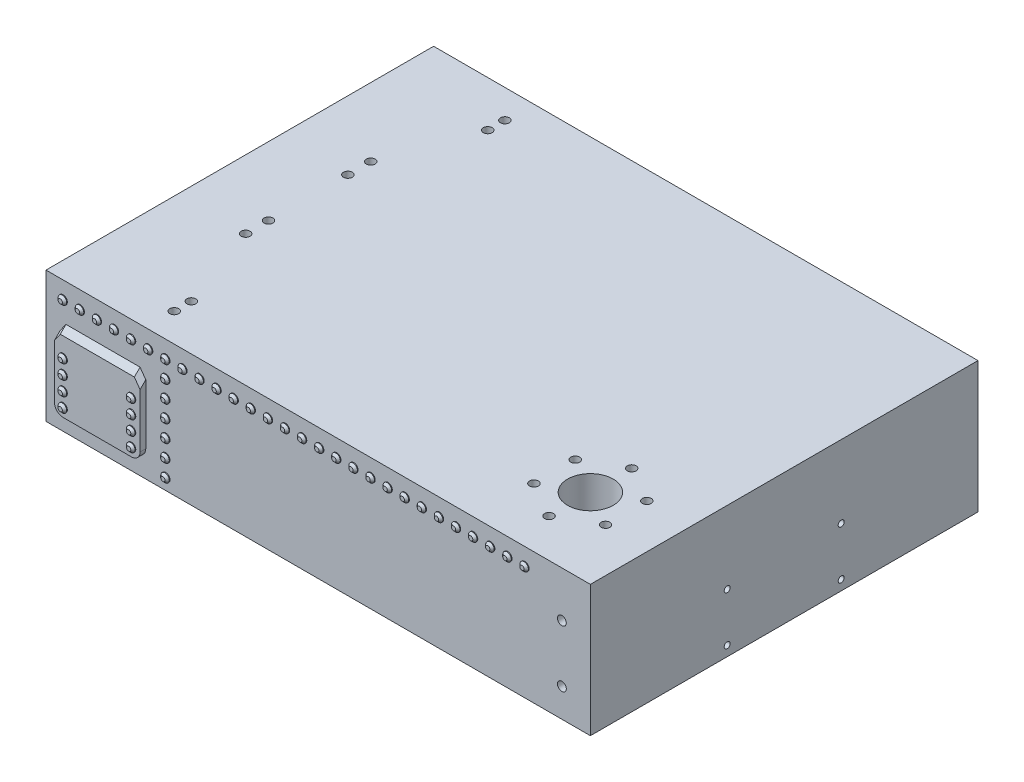
from build123d import *

# Parameters (mm, degrees)
BOSS_EXTRUDE1_DEPTH       = 46
CUT_EXTRUDE1_DEPTH        = 41
BOSS_EXTRUDE2_DEPTH       = 2
CHAMFER2_SIZE             = 2
FILLET1_R                 = 3
BOSS_EXTRUDE3_DEPTH       = 2
CHAMFER4_SIZE             = 2
FILLET2_R                 = 3
SKETCH23_R                = 1.4999999999999998
SKETCH23_R_2              = 1.5000000000000002
SKETCH23_R_3              = 1.5000000000000042
SKETCH23_R_4              = 1.5000000000000009
BOSS_EXTRUDE8_DEPTH       = 1
CHAMFER11_SIZE            = 0.75
CHAMFER11_OF_MIRROR1_SIZE = 0.75
SKETCH18_R                = 1.5000000000000013
BOSS_EXTRUDE7_DEPTH       = 14
SKETCH24_R                = 1.5000000000000018
SKETCH24_R_2              = 1.5000000000000009
SKETCH24_R_3              = 1.5000000000000042
SKETCH24_R_4              = 1.4999999999999973
BOSS_EXTRUDE9_DEPTH       = 1
CHAMFER12_SIZE            = 0.75
CHAMFER12_OF_MIRROR3_SIZE = 0.75
SKETCH25_R                = 1.5499999479999795
SKETCH25_R_2              = 1.54999994799998
CUT_EXTRUDE3_DEPTH        = 238.80874668523023
SKETCH26_R                = 1.54999994799998
SKETCH26_R_2              = 1.5499999479999795
CUT_EXTRUDE4_DEPTH        = 238.80874668523023
SKETCH28_R                = 1.549999948000008
SKETCH28_R_2              = 1.5499999479999795
SKETCH28_R_3              = 1.549999948000009
CUT_EXTRUDE5_DEPTH        = 240.75612609482997
SKETCH28_3_R              = 8.000000000000007
CUT_EXTRUDE6_DEPTH        = 240.75612609482997
BOSS_EXTRUDE10_START      = 40
SKETCH28_4_R              = 11.00000000000001
SKETCH28_4_R_2            = 8.000000000000007
BOSS_EXTRUDE10_DEPTH      = 40
CUT_EXTRUDE7_DEPTH        = 20
BOSS_EXTRUDE11_DEPTH      = 1.5
CIRPATTERN1_COUNT         = 6
CHAMFER13_SIZE            = 0.5
CUT_EXTRUDE8_REACH        = 241.756
SKETCH31_R                = 1.5500000000000007
SKETCH31_R_2              = 1.5500000000000012
SKETCH31_R_3              = 1.5499999999999932
CUT_EXTRUDE9_REACH        = 238.713
SKETCH32_R                = 1.549999999999994
SKETCH32_R_2              = 1.5499999999999992
CUT_EXTRUDE11_REACH       = 241.756
SKETCH35_R                = 1.5499999999999965
BOSS_EXTRUDE12_DEPTH      = 12
CHAMFER14_SIZE            = 2.999
SKETCH38_R                = 1.5499999999999932
SKETCH38_R_2              = 1.549999999999994
SKETCH38_R_3              = 1.5500000000000003
SKETCH38_R_4              = 1.549999999999999
CUT_EXTRUDE12_DEPTH       = 2
F_2_0MM_DOWEL_HOLE1_D     = 2
F_2_0MM_DOWEL_HOLE1_DEPTH = 12
F_2_0MM_DOWEL_HOLE1_TIP   = 0.6008606190275603
SKETCH43_R                = 1.0500000000000025
SKETCH43_R_2              = 1.049999999999995
SKETCH43_R_3              = 1.050000000000002
CUT_EXTRUDE13_DEPTH       = 237.71290628100536
CUT_EXTRUDE14_REACH       = 242.662
SKETCH44_R                = 1.0500000000000025
SKETCH44_R_2              = 1.049999999999995
SKETCH44_R_3              = 1.050000000000002


# Some blends are built 0.0001 mm under size
with BuildPart() as part:
    # Sketch1 → Boss-Extrude1 (new body)
    with BuildSketch(Plane(origin=(0, 0, 0), x_dir=(1, 0, 0), z_dir=(0, 1, 0))):
        Polygon((0, 0), (191, 0), (190.99999999999994, 136), (-5.551e-14, 136), align=None)
    extrude(amount=BOSS_EXTRUDE1_DEPTH)

    # Sketch3 → Cut-Extrude1 (cut)
    with BuildSketch(Plane.XZ):
        Polygon((4.999999999999945, -5), (186, -5), (186.00000000000003, -131), (4.9999999999999645, -131), align=None)
    extrude(amount=-CUT_EXTRUDE1_DEPTH, mode=Mode.SUBTRACT)

    # Sketch9 → Boss-Extrude2 (add)
    with BuildSketch(Plane(origin=(0, 0, -136), x_dir=(-1, 0, 0), z_dir=(0, 0, -1))):
        Polygon((-5.0000000000000275, 31), (-35.00000000000003, 30.999999999999996), (-34.99999999999994, 6.2152914347308945), (-4.9999999999999405, 6.215291434730898), align=None)
    extrude(amount=BOSS_EXTRUDE2_DEPTH)

    # Chamfer2
    chamfer2_edges = [part.edges().sort_by_distance(p)[0] for p in [
        (20.00000000000003, 31, -136),
    ]]
    chamfer(chamfer2_edges, length=CHAMFER2_SIZE - 0.0001)  # a hair under: the kernel refuses the full size

    # Fillet1
    fillet1_edges = [part.edges().sort_by_distance(p)[0] for p in [
        (4.9999999999999405, 6.215291434730898, -137),
        (34.99999999999994, 6.2152914347308945, -137),
    ]]
    fillet(fillet1_edges, radius=FILLET1_R)

    # Chamfer3
    # the kernel refuses this chamfer: 2 mm, written as the material it takes off along each edge
    with BuildSketch(Plane(origin=(35.00000000000005, 36.636808959705554, -132.36309104029445), x_dir=(-0.9996219169112968, 0.019442520806015526, -0.019442520806012088), z_dir=(-2.432610827546454e-15, -0.7071067811865476, -0.7071067811865476))) as chamfer3_piece_1_section:
        with BuildLine():
            Line((2.0573463903727274, 0), (-0.11309430977129796, -2.0542355870437667))
            Line((-0.11309430977129796, -2.0542355870437667), (-0.15307918644774898, -2.053135751979343))
            ThreePointArc((-0.15307918644774898, -2.053135751979343), (-0.06825845411927062, -1.0267956592897132), (-0.03998487667645102, 0.00109983506442341))
            Line((-0.03998487667645102, 0.00109983506442341), (0.00109983506442326, 0.03998487667644577))
            ThreePointArc((0.00109983506442326, 0.03998487667644577), (1.02899532941855, 0.01171129923362938), (2.0584462254371503, 0.03998487667644577))
            Line((2.0584462254371503, 0.03998487667644577), (2.0573463903727274, 0))
        make_face()
    chamfer3_piece_1 = extrude(amount=13.115017655253602, mode=Mode.PRIVATE)
    chamfer3_piece_1 = split(chamfer3_piece_1, bisect_by=Plane(origin=(34.18210852359201, 31.742511245489855, -136), z_dir=(0, 0, -1)), keep=Keep.TOP, mode=Mode.PRIVATE)
    add(chamfer3_piece_1, mode=Mode.SUBTRACT)
    with BuildSketch(Plane(origin=(5.000000000000047, 36.63680895970555, -132.36309104029445), x_dir=(-0.027495876610588645, -0.7068394360706732, 0.7068394360706735), z_dir=(-2.4832902197870053e-15, -0.7071067811865476, -0.7071067811865476))) as chamfer3_piece_2_section:
        with BuildLine():
            Line((2.0573463903727283, 0), (-0.11309430977130623, -2.054235587043767))
            Line((-0.11309430977130623, -2.054235587043767), (-0.15307918644775198, -2.053135751979344))
            ThreePointArc((-0.15307918644775198, -2.053135751979344), (-0.06825845411928508, -1.0267956592896998), (-0.03998487667644576, 0.00109983506442338))
            Line((-0.03998487667644576, 0.00109983506442338), (0.00109983506442355, 0.0399848766764519))
            ThreePointArc((0.00109983506442355, 0.0399848766764519), (1.0289953294185645, 0.0117112992336248), (2.0584462254371516, 0.03998487667645189))
            Line((2.0584462254371516, 0.03998487667645189), (2.0573463903727283, 0))
        make_face()
    chamfer3_piece_2 = extrude(amount=13.11501765525358, mode=Mode.PRIVATE)
    chamfer3_piece_2 = split(chamfer3_piece_2, bisect_by=Plane(origin=(5.81789147640913, 31.74251124548869, -136), z_dir=(0, 0, -1)), keep=Keep.TOP, mode=Mode.PRIVATE)
    add(chamfer3_piece_2, mode=Mode.SUBTRACT)

    # Sketch10 → Boss-Extrude3 (add)
    with BuildSketch(Plane.XY):
        Polygon((35.00000000000003, 30.999999999999996), (5.0000000000000275, 31), (4.9999999999999405, 6.215291434730898), (34.99999999999994, 6.2152914347308945), align=None)
    extrude(amount=BOSS_EXTRUDE3_DEPTH)

    # Chamfer4
    chamfer4_edges = [part.edges().sort_by_distance(p)[0] for p in [
        (20.00000000000003, 31, 0),
    ]]
    chamfer(chamfer4_edges, length=CHAMFER4_SIZE - 0.0001)  # a hair under: the kernel refuses the full size

    # Fillet2
    fillet2_edges = [part.edges().sort_by_distance(p)[0] for p in [
        (4.9999999999999405, 6.215291434730898, 1),
        (34.99999999999994, 6.2152914347308945, 1),
    ]]
    fillet(fillet2_edges, radius=FILLET2_R)

    # Chamfer5
    # the kernel refuses this chamfer: 2 mm, written as the material it takes off along each edge
    with BuildSketch(Plane(origin=(5.000000000000046, 36.636808959705554, -3.636908959705547), x_dir=(0.9996219169112968, 0.019442520806012466, 0.019442520806015978), z_dir=(-2.4832902197870053e-15, -0.7071067811865476, 0.7071067811865475))) as chamfer5_piece_1_section:
        with BuildLine():
            Line((2.057346390372729, 1e-17), (-0.11309430977131167, -2.0542355870437685))
            Line((-0.11309430977131167, -2.0542355870437685), (-0.15307918644776358, -2.053135751979345))
            ThreePointArc((-0.15307918644776358, -2.053135751979345), (-0.06825845411928075, -1.0267956592897038), (-0.0399848766764519, 0.00109983506442346))
            Line((-0.0399848766764519, 0.00109983506442346), (0.00109983506442354, 0.03998487667645487))
            ThreePointArc((0.00109983506442354, 0.03998487667645487), (1.0289953294185465, 0.01171129923363264), (2.058446225437152, 0.03998487667645488))
            Line((2.058446225437152, 0.03998487667645488), (2.057346390372729, 1e-17))
        make_face()
    chamfer5_piece_1 = extrude(amount=13.115017655253585, mode=Mode.PRIVATE)
    chamfer5_piece_1 = split(chamfer5_piece_1, bisect_by=Plane(origin=(5.81789147640932, 31.74251124548886, 0), z_dir=(0, 0, 1)), keep=Keep.TOP, mode=Mode.PRIVATE)
    add(chamfer5_piece_1, mode=Mode.SUBTRACT)
    with BuildSketch(Plane(origin=(35.00000000000005, 36.636808959705554, -3.636908959705554), x_dir=(0.027495876610582212, -0.7068394360706736, -0.7068394360706736), z_dir=(-2.432610827546454e-15, -0.7071067811865476, 0.7071067811865475))) as chamfer5_piece_2_section:
        with BuildLine():
            Line((2.0573463903727256, -1e-17), (-0.11309430977129922, -2.054235587043765))
            Line((-0.11309430977129922, -2.054235587043765), (-0.1530791864477541, -2.053135751979342))
            ThreePointArc((-0.1530791864477541, -2.053135751979342), (-0.06825845411927416, -1.0267956592897032), (-0.03998487667645487, 0.00109983506442337))
            Line((-0.03998487667645487, 0.00109983506442337), (0.00109983506442327, 0.03998487667645102))
            ThreePointArc((0.00109983506442327, 0.03998487667645102), (1.0289953294185419, 0.0117112992336214), (2.058446225437149, 0.039984876676451))
            Line((2.058446225437149, 0.039984876676451), (2.0573463903727256, -1e-17))
        make_face()
    chamfer5_piece_2 = extrude(amount=13.115017655253594, mode=Mode.PRIVATE)
    chamfer5_piece_2 = split(chamfer5_piece_2, bisect_by=Plane(origin=(34.18210852359054, 31.74251124548846, 0), z_dir=(0, 0, 1)), keep=Keep.TOP, mode=Mode.PRIVATE)
    add(chamfer5_piece_2, mode=Mode.SUBTRACT)

    # Sketch23 → Boss-Extrude8 (add)
    with BuildSketch(Plane.XY.offset(2)):
        with Locations((7.9999999999999165, 19.2152914347309)):
            Circle(SKETCH23_R)
        with Locations((7.999999999999934, 14.215291434730899)):
            Circle(SKETCH23_R)
        with Locations((7.999999999999952, 9.215291434730897)):
            Circle(SKETCH23_R_2)
        with Locations((31.999999999999954, 9.215291434730894)):
            Circle(SKETCH23_R_3)
        with Locations((31.999999999999932, 14.215291434730895)):
            Circle(SKETCH23_R_3)
        with Locations((31.99999999999992, 19.215291434730894)):
            Circle(SKETCH23_R_3)
        with Locations((31.999999999999897, 24.215291434730894)):
            Circle(SKETCH23_R_3)
        with Locations((7.9999999999999, 24.215291434730897)):
            Circle(SKETCH23_R_4)
    boss_extrude8 = extrude(amount=BOSS_EXTRUDE8_DEPTH)

    # Chamfer11
    chamfer11_edges = [part.edges().sort_by_distance(p)[0] for p in [
        (6.4999999999999165, 19.2152914347309, 3),
        (6.499999999999934, 14.215291434730899, 3),
        (6.499999999999952, 9.215291434730897, 3),
        (30.49999999999995, 9.215291434730894, 3),
        (30.49999999999993, 14.215291434730895, 3),
        (30.499999999999915, 19.215291434730894, 3),
        (30.499999999999893, 24.215291434730894, 3),
        (6.499999999999899, 24.215291434730897, 3),
    ]]
    chamfer(chamfer11_edges, length=CHAMFER11_SIZE)

    # Mirror1: Boss-Extrude8 across plane
    add(boss_extrude8.mirror(Plane.XY.offset(-68)))

    # Chamfer11 of Mirror1
    chamfer11_of_mirror1_edges = [part.edges().sort_by_distance(p)[0] for p in [
        (6.4999999999999165, 19.2152914347309, -139),
        (6.499999999999934, 14.215291434730899, -139),
        (6.499999999999952, 9.215291434730897, -139),
        (30.49999999999995, 9.215291434730894, -139),
        (30.49999999999993, 14.215291434730895, -139),
        (30.499999999999915, 19.215291434730894, -139),
        (30.499999999999893, 24.215291434730894, -139),
        (6.499999999999899, 24.215291434730897, -139),
    ]]
    chamfer(chamfer11_of_mirror1_edges, length=CHAMFER11_OF_MIRROR1_SIZE)

    # Sketch18 → Boss-Extrude7 (add)
    # profile 1 of 8: a face of its own
    with BuildSketch(Plane.XZ.offset(-41)):
        Polygon((72.47031053752059, -69.16911511108783), (76.12968946247946, -69.1691151110878), (77.95937892495886, -66.00000000000006), (76.12968946247942, -62.830884888912294), (72.47031053752053, -62.83088488891231), (70.64062107504112, -66.00000000000009), align=None)
        with Locations((74.3, -66.00000000000006)):
            Circle(SKETCH18_R, mode=Mode.SUBTRACT)
    # profile 2 of 8: a face of its own
    with BuildSketch(Plane.XZ.offset(-41)):
        with Locations((74.3, -66.00000000000006)):
            Circle(SKETCH18_R)
    # profile 3 of 8: a face of its own
    with BuildSketch(Plane.XZ.offset(-41)):
        Polygon((72.27927405783633, -117.50000000000004), (76.32072594216369, -117.50000000000004), (78.3414518843274, -114.00000000000003), (76.32072594216372, -110.50000000000007), (72.27927405783633, -110.50000000000007), (70.25854811567265, -114.00000000000006), align=None)
        with Locations((74.30000000000003, -114.00000000000004)):
            Circle(SKETCH18_R, mode=Mode.SUBTRACT)
    # profile 4 of 8: a face of its own
    with BuildSketch(Plane.XZ.offset(-41)):
        with Locations((74.30000000000003, -114.00000000000004)):
            Circle(SKETCH18_R)
    # profile 5 of 8: a face of its own
    with BuildSketch(Plane.XZ.offset(-41)):
        Polygon((172.47927405783636, -116.50000000000001), (176.52072594216372, -116.49999999999997), (178.5414518843274, -113.00000000000001), (176.5207259421637, -109.50000000000003), (172.4792740578363, -109.50000000000004), (170.45854811567264, -113.00000000000004), align=None)
        with Locations((174.50000000000003, -113.00000000000001)):
            Circle(SKETCH18_R, mode=Mode.SUBTRACT)
    # profile 6 of 8: a face of its own
    with BuildSketch(Plane.XZ.offset(-41)):
        with Locations((174.50000000000003, -113.00000000000001)):
            Circle(SKETCH18_R)
    # profile 7 of 8: a face of its own
    with BuildSketch(Plane.XZ.offset(-41)):
        Polygon((172.47927405783628, -64.00000000000003), (176.5207259421637, -64.00000000000003), (178.5414518843274, -60.50000000000004), (176.52072594216366, -57.00000000000001), (172.4792740578363, -57.00000000000001), (170.45854811567258, -60.50000000000005), align=None)
        with Locations((174.5, -60.50000000000003)):
            Circle(SKETCH18_R, mode=Mode.SUBTRACT)
    # profile 8 of 8: a face of its own
    with BuildSketch(Plane.XZ.offset(-41)):
        with Locations((174.5, -60.50000000000003)):
            Circle(SKETCH18_R)
    extrude(amount=BOSS_EXTRUDE7_DEPTH)

    # Sketch24 → Boss-Extrude9 (add)
    with BuildSketch(Plane.XY):
        with Locations(Location((6, 40, 0), (0, 0, 180))):
            Circle(SKETCH24_R)
        with Locations(Location((12, 40, 0), (0, 0, 180))):
            Circle(SKETCH24_R_2)
        with Locations(Location((18.000000000000004, 40, 0), (0, 0, 180))):
            Circle(SKETCH24_R_2)
        with Locations(Location((24, 40, 0), (0, 0, 180))):
            Circle(SKETCH24_R_3)
        with Locations(Location((30, 40, 0), (0, 0, 180))):
            Circle(SKETCH24_R_3)
        with Locations(Location((36, 40, 0), (0, 0, 180))):
            Circle(SKETCH24_R_3)
        with Locations(Location((42, 40, 0), (0, 0, 180))):
            Circle(SKETCH24_R_3)
        with Locations(Location((48, 40, 0), (0, 0, 180))):
            Circle(SKETCH24_R_3)
        with Locations(Location((54, 40, 0), (0, 0, 180))):
            Circle(SKETCH24_R_3)
        with Locations(Location((60, 40, 0), (0, 0, 180))):
            Circle(SKETCH24_R_3)
        with Locations(Location((66, 40, 0), (0, 0, 180))):
            Circle(SKETCH24_R_4)
        with Locations(Location((72.00000000000001, 40, 0), (0, 0, 180))):
            Circle(SKETCH24_R_4)
        with Locations(Location((78.00000000000001, 40, 0), (0, 0, 180))):
            Circle(SKETCH24_R_4)
        with Locations(Location((84, 40, 0), (0, 0, 180))):
            Circle(SKETCH24_R_4)
        with Locations(Location((90.00000000000001, 40, 0), (0, 0, 180))):
            Circle(SKETCH24_R_4)
        with Locations(Location((96, 40, 0), (0, 0, 180))):
            Circle(SKETCH24_R_4)
        with Locations(Location((102.00000000000001, 40, 0), (0, 0, 180))):
            Circle(SKETCH24_R_4)
        with Locations(Location((108.00000000000001, 40, 0), (0, 0, 180))):
            Circle(SKETCH24_R_4)
        with Locations(Location((114, 40, 0), (0, 0, 180))):
            Circle(SKETCH24_R_4)
        with Locations(Location((120.00000000000001, 40, 0), (0, 0, 180))):
            Circle(SKETCH24_R_4)
        with Locations(Location((126, 40, 0), (0, 0, 180))):
            Circle(SKETCH24_R_4)
        with Locations(Location((132, 40, 0), (0, 0, 180))):
            Circle(SKETCH24_R_4)
        with Locations(Location((138, 40, 0), (0, 0, 180))):
            Circle(SKETCH24_R_4)
        with Locations(Location((144.00000000000003, 40, 0), (0, 0, 180))):
            Circle(SKETCH24_R_4)
        with Locations(Location((150.00000000000003, 40, 0), (0, 0, 180))):
            Circle(SKETCH24_R_4)
        with Locations(Location((156, 40, 0), (0, 0, 180))):
            Circle(SKETCH24_R_4)
        with Locations(Location((162, 40, 0), (0, 0, 180))):
            Circle(SKETCH24_R_4)
        with Locations(Location((168, 40, 0), (0, 0, 180))):
            Circle(SKETCH24_R_4)
        with Locations(Location((42.000000000000064, 34, 0), (0, 0, 180))):
            Circle(SKETCH24_R_3)
        with Locations(Location((42.00000000000013, 28, 0), (0, 0, 180))):
            Circle(SKETCH24_R_3)
        with Locations(Location((42.00000000000019, 22, 0), (0, 0, 180))):
            Circle(SKETCH24_R_3)
        with Locations(Location((42.000000000000256, 16, 0), (0, 0, 180))):
            Circle(SKETCH24_R_3)
        with Locations(Location((42.00000000000031, 10.000000000000002, 0), (0, 0, 180))):
            Circle(SKETCH24_R_3)
        with Locations(Location((42.00000000000038, 3.9999999999999964, 0), (0, 0, 180))):
            Circle(SKETCH24_R_3)
    boss_extrude9 = extrude(amount=BOSS_EXTRUDE9_DEPTH)

    # Chamfer12
    chamfer12_edges = [part.edges().sort_by_distance(p)[0] for p in [
        (7.500000000000002, 40, 1),
        (13.5, 40, 1),
        (19.500000000000004, 40, 1),
        (25.500000000000004, 40, 1),
        (31.500000000000004, 40, 1),
        (37.50000000000001, 40, 1),
        (43.50000000000001, 40, 1),
        (49.50000000000001, 40, 1),
        (55.50000000000001, 40, 1),
        (61.50000000000001, 40, 1),
        (67.5, 40, 1),
        (73.50000000000001, 40, 1),
        (79.50000000000001, 40, 1),
        (85.5, 40, 1),
        (91.50000000000001, 40, 1),
        (97.5, 40, 1),
        (103.50000000000001, 40, 1),
        (109.50000000000001, 40, 1),
        (115.5, 40, 1),
        (121.50000000000001, 40, 1),
        (127.5, 40, 1),
        (133.5, 40, 1),
        (139.5, 40, 1),
        (145.50000000000003, 40, 1),
        (151.50000000000003, 40, 1),
        (157.5, 40, 1),
        (163.5, 40, 1),
        (169.5, 40, 1),
        (43.50000000000007, 34, 1),
        (43.500000000000135, 28, 1),
        (43.5000000000002, 22, 1),
        (43.50000000000026, 16, 1),
        (43.50000000000032, 10.000000000000002, 1),
        (43.500000000000384, 3.999999999999996, 1),
    ]]
    chamfer(chamfer12_edges, length=CHAMFER12_SIZE)

    # Mirror3: Boss-Extrude9 across plane
    add(boss_extrude9.mirror(Plane.XY.offset(-68)))

    # Chamfer12 of Mirror3
    chamfer12_of_mirror3_edges = [part.edges().sort_by_distance(p)[0] for p in [
        (7.500000000000002, 40, -137),
        (13.5, 40, -137),
        (19.500000000000004, 40, -137),
        (25.500000000000004, 40, -137),
        (31.500000000000004, 40, -137),
        (37.50000000000001, 40, -137),
        (43.50000000000001, 40, -137),
        (49.50000000000001, 40, -137),
        (55.50000000000001, 40, -137),
        (61.50000000000001, 40, -137),
        (67.5, 40, -137),
        (73.50000000000001, 40, -137),
        (79.50000000000001, 40, -137),
        (85.5, 40, -137),
        (91.50000000000001, 40, -137),
        (97.5, 40, -137),
        (103.50000000000001, 40, -137),
        (109.50000000000001, 40, -137),
        (115.5, 40, -137),
        (121.50000000000001, 40, -137),
        (127.5, 40, -137),
        (133.5, 40, -137),
        (139.5, 40, -137),
        (145.50000000000003, 40, -137),
        (151.50000000000003, 40, -137),
        (157.5, 40, -137),
        (163.5, 40, -137),
        (169.5, 40, -137),
        (43.50000000000007, 34, -137),
        (43.500000000000135, 28, -137),
        (43.5000000000002, 22, -137),
        (43.50000000000026, 16, -137),
        (43.50000000000032, 10.000000000000002, -137),
        (43.500000000000384, 3.999999999999996, -137),
    ]]
    chamfer(chamfer12_of_mirror3_edges, length=CHAMFER12_OF_MIRROR3_SIZE)

    # Sketch25 → Cut-Extrude3 (cut, through all)
    with BuildSketch(Plane.XY.offset(-131)):
        with Locations((180.99999999999994, 30)):
            Circle(SKETCH25_R)
        with Locations((180.99999999999994, 9.999999999999998)):
            Circle(SKETCH25_R_2)
    extrude(amount=-CUT_EXTRUDE3_DEPTH, mode=Mode.SUBTRACT)

    # Sketch26 → Cut-Extrude4 (cut, through all)
    with BuildSketch(Plane(origin=(0, 0, -5), x_dir=(-1, 0, 0), z_dir=(0, 0, -1))):
        with Locations(Location((-180.99999999999994, 9.999999999999998, 0), (0, 0, 180))):
            Circle(SKETCH26_R)
        with Locations(Location((-180.99999999999994, 30, 0), (0, 0, 180))):
            Circle(SKETCH26_R_2)
    extrude(amount=-CUT_EXTRUDE4_DEPTH, mode=Mode.SUBTRACT)

    # Sketch28 → Cut-Extrude5 (cut, through all)
    with BuildSketch(Plane.XZ.offset(-41)):
        with Locations(Location((163, -42.50000000000002, 0), (0, 0, 270))):
            Circle(SKETCH28_R)
        with Locations(Location((175.55736835487437, -35.25000000000001, 0), (0, 0, 270))):
            Circle(SKETCH28_R_2)
        with Locations(Location((175.55736835487437, -20.750000000000007, 0), (0, 0, 270))):
            Circle(SKETCH28_R_2)
        with Locations(Location((162.99999999999997, -13.500000000000025, 0), (0, 0, 270))):
            Circle(SKETCH28_R_3)
        with Locations(Location((150.44263164512563, -20.750000000000036, 0), (0, 0, 270))):
            Circle(SKETCH28_R_2)
        with Locations(Location((150.44263164512563, -35.250000000000036, 0), (0, 0, 270))):
            Circle(SKETCH28_R)
    extrude(amount=-CUT_EXTRUDE5_DEPTH, mode=Mode.SUBTRACT)

    # Sketch28<3> → Cut-Extrude6 (cut, through all)
    with BuildSketch(Plane.XZ.offset(-41)):
        with Locations(Location((163, -28.000000000000025, 0), (0, 0, 270))):
            Circle(SKETCH28_3_R)
    extrude(amount=-CUT_EXTRUDE6_DEPTH, mode=Mode.SUBTRACT)

    # Sketch28<4> → Boss-Extrude10 (add)
    with BuildSketch(Plane.XZ.offset(-41).offset(BOSS_EXTRUDE10_START)):
        with Locations(Location((163, -28.000000000000025, 0), (0, 0, 270))):
            Circle(SKETCH28_4_R)
        with Locations(Location((163, -28.000000000000025, 0), (0, 0, 270))):
            Circle(SKETCH28_4_R_2, mode=Mode.SUBTRACT)
    extrude(amount=-BOSS_EXTRUDE10_DEPTH)

    # Sketch29 → Cut-Extrude7 (cut)
    with BuildSketch(Plane.XZ.offset(-1.0000000000000009)):
        Polygon((163.00000000000006, -43.00579548007377), (162.00000000000006, -43.00579548007377), (162.00000000000006, -13.005795480073774), (164.00000000000006, -13.005795480073774), (164.00000000000006, -43.00579548007377), align=None)
    extrude(amount=-CUT_EXTRUDE7_DEPTH, mode=Mode.SUBTRACT)

    # Sketch30 → Boss-Extrude11 (add, symmetric)
    with BuildSketch(Plane(origin=(163, 46.00000000000001, -28.000000000000025), x_dir=(1, 0, 0), z_dir=(0, 0, 1))):
        Polygon((17, -7.928571428571455), (17, -4.999999999999997), (10.900000000000066, -4.999999999999997), (10.900000000000066, -22.571428571428537), (11.000000000000066, -22.571428571428537), (12.000000000000068, -22.57142857142854), align=None)
    boss_extrude11 = extrude(amount=BOSS_EXTRUDE11_DEPTH, both=True)

    # CirPattern1: Boss-Extrude11 ×6 about axis
    cirpattern1_axis = Axis((163.00000000000009, 0, -27.999999999999854), (0, 1, 0))
    for i in range(1, CIRPATTERN1_COUNT):
        add(boss_extrude11.rotate(cirpattern1_axis, i * 360 / CIRPATTERN1_COUNT))

    # Chamfer13
    chamfer13_edges = [part.edges().sort_by_distance(p)[0] for p in [
        (174, 1, -28.00000000000021),
        (152, 1, -28.000000000000195),
    ]]
    chamfer(chamfer13_edges, length=CHAMFER13_SIZE)

    # Sketch31 → Cut-Extrude8 (cut, up to next)
    with BuildSketch(Plane.XZ.offset(-41), mode=Mode.PRIVATE) as cut_extrude8_sk1:
        with Locations(Location((34.99999999999999, -16.000000000000014, 0), (0, 0, 270))):
            Circle(SKETCH31_R)
    cut_extrude8_tool1 = extrude(cut_extrude8_sk1.sketch, amount=-CUT_EXTRUDE8_REACH, mode=Mode.PRIVATE) & part.part
    # Sketch31 → Cut-Extrude8 (cut, up to next)
    with BuildSketch(Plane.XZ.offset(-41), mode=Mode.PRIVATE) as cut_extrude8_sk2:
        with Locations(Location((34.99999999999999, -10.000000000000016, 0), (0, 0, 270))):
            Circle(SKETCH31_R_2)
    cut_extrude8_tool2 = extrude(cut_extrude8_sk2.sketch, amount=-CUT_EXTRUDE8_REACH, mode=Mode.PRIVATE) & part.part
    # Sketch31 → Cut-Extrude8 (cut, up to next)
    with BuildSketch(Plane.XZ.offset(-41), mode=Mode.PRIVATE) as cut_extrude8_sk3:
        with Locations(Location((34.99999999999995, -126.00000000000003, 0), (0, 0, 270))):
            Circle(SKETCH31_R_3)
    cut_extrude8_tool3 = extrude(cut_extrude8_sk3.sketch, amount=-CUT_EXTRUDE8_REACH, mode=Mode.PRIVATE) & part.part
    # Sketch31 → Cut-Extrude8 (cut, up to next)
    with BuildSketch(Plane.XZ.offset(-41), mode=Mode.PRIVATE) as cut_extrude8_sk4:
        with Locations(Location((34.99999999999995, -120.00000000000003, 0), (0, 0, 270))):
            Circle(SKETCH31_R_3)
    cut_extrude8_tool4 = extrude(cut_extrude8_sk4.sketch, amount=-CUT_EXTRUDE8_REACH, mode=Mode.PRIVATE) & part.part
    add(cut_extrude8_tool1.solids().sort_by_distance((35, 41, -16))[0], mode=Mode.SUBTRACT)
    add(cut_extrude8_tool2.solids().sort_by_distance((35, 41, -10))[0], mode=Mode.SUBTRACT)
    add(cut_extrude8_tool3.solids().sort_by_distance((35, 41, -126))[0], mode=Mode.SUBTRACT)
    add(cut_extrude8_tool4.solids().sort_by_distance((35, 41, -120))[0], mode=Mode.SUBTRACT)

    # Sketch32 → Cut-Extrude9 (cut, up to next)
    with BuildSketch(Plane(origin=(4.999999999999944, 0, 7.9e-16), x_dir=(1.6e-16, 0, -1), z_dir=(1, 0, 1.6e-16)), mode=Mode.PRIVATE) as cut_extrude9_sk1:
        with Locations((125.5, 17.250000000000007)):
            Circle(SKETCH32_R)
    cut_extrude9_tool1 = extrude(cut_extrude9_sk1.sketch, amount=-CUT_EXTRUDE9_REACH, mode=Mode.PRIVATE) & part.part
    # Sketch32 → Cut-Extrude9 (cut, up to next)
    with BuildSketch(Plane(origin=(4.999999999999944, 0, 7.9e-16), x_dir=(1.6e-16, 0, -1), z_dir=(1, 0, 1.6e-16)), mode=Mode.PRIVATE) as cut_extrude9_sk2:
        with Locations((10.500000000000002, 17.250000000000018)):
            Circle(SKETCH32_R_2)
    cut_extrude9_tool2 = extrude(cut_extrude9_sk2.sketch, amount=-CUT_EXTRUDE9_REACH, mode=Mode.PRIVATE) & part.part
    add(cut_extrude9_tool1.solids().sort_by_distance((5, 17.25, -125.5))[0], mode=Mode.SUBTRACT)
    add(cut_extrude9_tool2.solids().sort_by_distance((5, 17.25, -10.5))[0], mode=Mode.SUBTRACT)

    # Sketch35 → Cut-Extrude11 (cut, up to next)
    with BuildSketch(Plane.XZ.offset(-41), mode=Mode.PRIVATE) as cut_extrude11_sk1:
        with Locations(Location((23.999999999999975, -46.06919557412727, 0), (0, 0, 270))):
            Circle(SKETCH35_R)
    cut_extrude11_tool1 = extrude(cut_extrude11_sk1.sketch, amount=-CUT_EXTRUDE11_REACH, mode=Mode.PRIVATE) & part.part
    # Sketch35 → Cut-Extrude11 (cut, up to next)
    with BuildSketch(Plane.XZ.offset(-41), mode=Mode.PRIVATE) as cut_extrude11_sk2:
        with Locations(Location((23.99999999999997, -54.069195574127264, 0), (0, 0, 270))):
            Circle(SKETCH35_R)
    cut_extrude11_tool2 = extrude(cut_extrude11_sk2.sketch, amount=-CUT_EXTRUDE11_REACH, mode=Mode.PRIVATE) & part.part
    # Sketch35 → Cut-Extrude11 (cut, up to next)
    with BuildSketch(Plane.XZ.offset(-41), mode=Mode.PRIVATE) as cut_extrude11_sk3:
        with Locations(Location((23.999999999999957, -81.93080442587276, 0), (0, 0, 270))):
            Circle(SKETCH35_R)
    cut_extrude11_tool3 = extrude(cut_extrude11_sk3.sketch, amount=-CUT_EXTRUDE11_REACH, mode=Mode.PRIVATE) & part.part
    # Sketch35 → Cut-Extrude11 (cut, up to next)
    with BuildSketch(Plane.XZ.offset(-41), mode=Mode.PRIVATE) as cut_extrude11_sk4:
        with Locations(Location((23.999999999999954, -89.93080442587275, 0), (0, 0, 270))):
            Circle(SKETCH35_R)
    cut_extrude11_tool4 = extrude(cut_extrude11_sk4.sketch, amount=-CUT_EXTRUDE11_REACH, mode=Mode.PRIVATE) & part.part
    add(cut_extrude11_tool1.solids().sort_by_distance((24, 41, -46.069196))[0], mode=Mode.SUBTRACT)
    add(cut_extrude11_tool2.solids().sort_by_distance((24, 41, -54.069196))[0], mode=Mode.SUBTRACT)
    add(cut_extrude11_tool3.solids().sort_by_distance((24, 41, -81.930804))[0], mode=Mode.SUBTRACT)
    add(cut_extrude11_tool4.solids().sort_by_distance((24, 41, -89.930804))[0], mode=Mode.SUBTRACT)

    # Sketch37 → Boss-Extrude12 (add)
    with BuildSketch(Plane.XZ):
        with BuildLine():
            Line((134.2000000000077, -131), (140.2000000000077, -131))
            ThreePointArc((140.2000000000077, -131), (139.32132034356732, -128.87867965644037), (137.2000000000077, -128))
            ThreePointArc((137.2000000000077, -127.99999999999999), (135.07867965644806, -128.87867965644037), (134.2000000000077, -131))
        make_face()
        with BuildLine():
            ThreePointArc((137.2000000000083, -7.999999999999993), (139.32132034356792, -7.121320343559638), (140.2000000000083, -5.000000000000001))
            Line((140.2000000000083, -5), (134.2000000000083, -5))
            ThreePointArc((134.2000000000083, -5), (135.07867965644866, -7.121320343559635), (137.2000000000083, -7.999999999999988))
        make_face()
        with BuildLine():
            ThreePointArc((4.999999999999946, -8.000000000000002), (7.121320343559589, -7.121320343559644), (7.999999999999947, -5.000000000000001))
            Line((7.999999999999947, -5), (4.999999999999945, -5))
            Line((4.999999999999945, -5), (4.999999999999946, -8))
        make_face()
        with BuildLine():
            Line((4.999999999999972, -131), (7.999999999999972, -131))
            ThreePointArc((7.99999999999997, -131), (7.121320343559618, -128.87867965644034), (4.999999999999964, -128))
            Line((4.999999999999964, -128), (4.9999999999999645, -131))
        make_face()
    extrude(amount=-BOSS_EXTRUDE12_DEPTH)

    # Chamfer14
    chamfer14_edges = [part.edges().sort_by_distance(p)[0] for p in [
        (137.20000000000763, 12, -127.99999999999999),
        (137.2000000000083, 12, -7.9999999999999805),
        (7.121320343559589, 12, -7.121320343559644),
        (7.121320343559622, 12, -128.87867965644034),
    ]]
    chamfer(chamfer14_edges, length=CHAMFER14_SIZE)

    # Sketch38 → Cut-Extrude12 (cut)
    with BuildSketch(Plane.XZ):
        with Locations(Location((137.2000000000077, -131, 0), (0, 0, 270))):
            Circle(SKETCH38_R)
        with Locations(Location((137.2000000000083, -5.000000000000004, 0), (0, 0, 270))):
            Circle(SKETCH38_R_2)
        with Locations(Location((4.999999999999942, -5.000000000000004, 0), (0, 0, 270))):
            Circle(SKETCH38_R_3)
        with Locations(Location((4.999999999999963, -131, 0), (0, 0, 270))):
            Circle(SKETCH38_R_4)
    extrude(amount=-CUT_EXTRUDE12_DEPTH, mode=Mode.SUBTRACT)

    # Ø2.0mm Dowel Hole1
    with Locations(Plane(origin=(0, 27.000000000000004, 0), x_dir=(-1, 0, 0), z_dir=(0, -1, 0))):
        with Locations((-74.3, 66), (-74.3, 114), (-174.5, 113), (-174.5, 60.5)):
            Hole(F_2_0MM_DOWEL_HOLE1_D / 2, depth=F_2_0MM_DOWEL_HOLE1_DEPTH)
            with Locations((0, 0, -(F_2_0MM_DOWEL_HOLE1_DEPTH + F_2_0MM_DOWEL_HOLE1_TIP / 2))):  # 118° drill point
                Cone(0, F_2_0MM_DOWEL_HOLE1_D / 2, F_2_0MM_DOWEL_HOLE1_TIP, mode=Mode.SUBTRACT)

    # Sketch43 → Cut-Extrude13 (cut, through all)
    with BuildSketch(Plane(origin=(4.999999999999944, 0, 7.9e-16), x_dir=(1.6e-16, 0, -1), z_dir=(1, 0, 1.6e-16))):
        with Locations((47.99999999999994, 15.949999999999996)):
            Circle(SKETCH43_R)
        with Locations((87.99999999999994, 15.949999999999996)):
            Circle(SKETCH43_R_2)
        with Locations((87.99999999999994, -1.0500000000000036)):
            Circle(SKETCH43_R_2)
        with Locations((47.99999999999994, -1.0500000000000036)):
            Circle(SKETCH43_R_3)
    extrude(amount=-CUT_EXTRUDE13_DEPTH, mode=Mode.SUBTRACT)

    # Sketch44 → Cut-Extrude14 (cut, up to next)
    with BuildSketch(Plane(origin=(191, 0, -7.796e-14), x_dir=(-4.1e-16, 0, -1), z_dir=(1, 0, -4.1e-16)), mode=Mode.PRIVATE) as cut_extrude14_sk1:
        with Locations((47.999999999999915, 20.50000000000001)):
            Circle(SKETCH44_R)
    cut_extrude14_tool1 = extrude(cut_extrude14_sk1.sketch, amount=-CUT_EXTRUDE14_REACH, mode=Mode.PRIVATE) & part.part
    # Sketch44 → Cut-Extrude14 (cut, up to next)
    with BuildSketch(Plane(origin=(191, 0, -7.796e-14), x_dir=(-4.1e-16, 0, -1), z_dir=(1, 0, -4.1e-16)), mode=Mode.PRIVATE) as cut_extrude14_sk2:
        with Locations((87.99999999999991, 20.50000000000001)):
            Circle(SKETCH44_R_2)
    cut_extrude14_tool2 = extrude(cut_extrude14_sk2.sketch, amount=-CUT_EXTRUDE14_REACH, mode=Mode.PRIVATE) & part.part
    # Sketch44 → Cut-Extrude14 (cut, up to next)
    with BuildSketch(Plane(origin=(191, 0, -7.796e-14), x_dir=(-4.1e-16, 0, -1), z_dir=(1, 0, -4.1e-16)), mode=Mode.PRIVATE) as cut_extrude14_sk3:
        with Locations((87.99999999999991, 3.5000000000000133)):
            Circle(SKETCH44_R_2)
    cut_extrude14_tool3 = extrude(cut_extrude14_sk3.sketch, amount=-CUT_EXTRUDE14_REACH, mode=Mode.PRIVATE) & part.part
    # Sketch44 → Cut-Extrude14 (cut, up to next)
    with BuildSketch(Plane(origin=(191, 0, -7.796e-14), x_dir=(-4.1e-16, 0, -1), z_dir=(1, 0, -4.1e-16)), mode=Mode.PRIVATE) as cut_extrude14_sk4:
        with Locations((47.999999999999915, 3.5000000000000133)):
            Circle(SKETCH44_R_3)
    cut_extrude14_tool4 = extrude(cut_extrude14_sk4.sketch, amount=-CUT_EXTRUDE14_REACH, mode=Mode.PRIVATE) & part.part
    add(cut_extrude14_tool1.solids().sort_by_distance((191, 20.5, -48))[0], mode=Mode.SUBTRACT)
    add(cut_extrude14_tool2.solids().sort_by_distance((191, 20.5, -88))[0], mode=Mode.SUBTRACT)
    add(cut_extrude14_tool3.solids().sort_by_distance((191, 3.5, -88))[0], mode=Mode.SUBTRACT)
    add(cut_extrude14_tool4.solids().sort_by_distance((191, 3.5, -48))[0], mode=Mode.SUBTRACT)


solid = part.part
